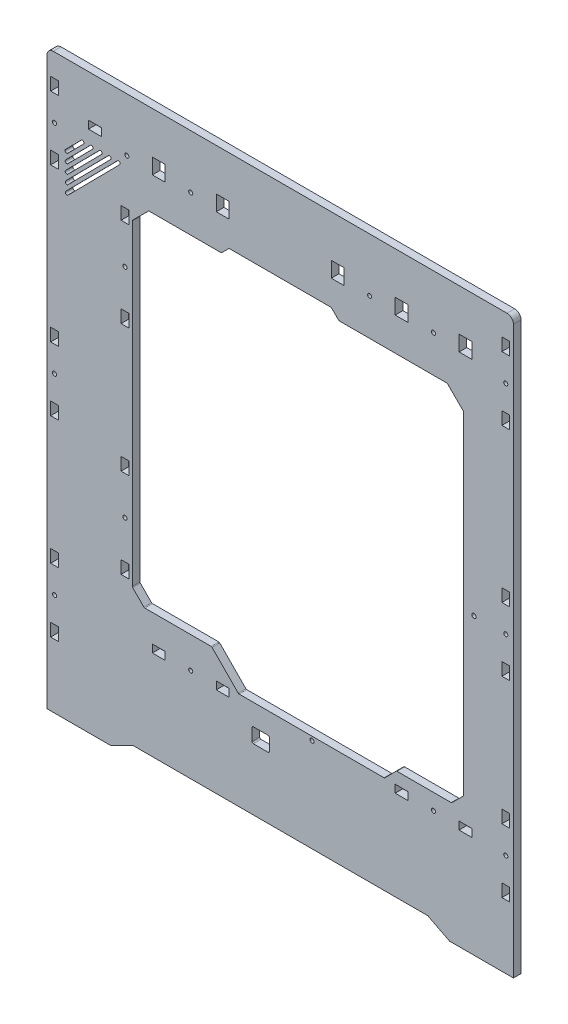
from build123d import *

# Parameters (mm, degrees)
SKETCH_1_W      = 6.1
SKETCH_1_H      = 10
SKETCH_1_R      = 1.6
SKETCH_1_W_2    = 10
SKETCH_1_H_2    = 6.1
SKETCH_1_H_3    = 12.1
SKETCH_1_R_2    = 1.7
EXTRUDE_1_DEPTH = 6


with BuildPart() as part:
    # Эскиз1 → Бобышка-Вытянуть1 (new body)
    with BuildSketch(Plane.XY):
        with BuildLine():
            Line((909.866546195, 490.00723929), (830.508682195, 490.00723929))
            Line((830.508682195, 490.00723929), (773.366546195, 490.00723929))
            ThreePointArc((773.366546195, 490.00723929), (769.831012289, 488.542773196), (768.366546195, 485.00723929))
            Line((768.366546195, 485.00723929), (768.366546195, 477.00723929))
            Line((768.366546195, 477.00723929), (768.366546195, 42.00723929))
            Line((768.366546195, 42.00723929), (818.366546195, 42.00723929))
            Line((818.366546195, 42.00723929), (835.366546195, 50.73749629))
            Line((835.366546195, 50.73749629), (1066.366546195, 50.73749629))
            Line((1066.366546195, 50.73749629), (1083.366546195, 42.00723929))
            Line((1083.366546195, 42.00723929), (1133.366546195, 42.00723929))
            Line((1133.366546195, 42.00723929), (1133.366546195, 477.00723929))
            Line((1133.366546195, 477.00723929), (1133.366546195, 485.00723929))
            ThreePointArc((1133.366546195, 485.00723929), (1131.902080101, 488.542773196), (1128.366546195, 490.00723929))
            Line((1128.366546195, 490.00723929), (909.866546195, 490.00723929))
        make_face()
        with Locations((774.316546195, 97.00723929)):
            Rectangle(SKETCH_1_W, SKETCH_1_H, mode=Mode.SUBTRACT)
        with Locations((774.316546195, 122.00723929)):
            Circle(SKETCH_1_R, mode=Mode.SUBTRACT)
        with Locations((774.316546195, 147.00723929)):
            Rectangle(SKETCH_1_W, SKETCH_1_H, mode=Mode.SUBTRACT)
        with Locations((855.866546195, 124.05491429)):
            Rectangle(SKETCH_1_W_2, SKETCH_1_H_2, mode=Mode.SUBTRACT)
        with Locations((880.866546195, 124.05491429)):
            Circle(SKETCH_1_R, mode=Mode.SUBTRACT)
        with Locations((905.866546195, 124.05491429)):
            Rectangle(SKETCH_1_W_2, SKETCH_1_H_2, mode=Mode.SUBTRACT)
        with BuildLine():
            Line((929.866546195, 110.50491429), (941.366546195, 110.50491429))
            ThreePointArc((941.366546195, 110.50491429), (942.073652976, 110.212021071), (942.366546195, 109.50491429))
            Line((942.366546195, 109.50491429), (942.366546195, 100.00491429))
            ThreePointArc((942.366546195, 100.00491429), (942.073652976, 99.297807509), (941.366546195, 99.00491429))
            Line((941.366546195, 99.00491429), (929.866546195, 99.00491429))
            ThreePointArc((929.866546195, 99.00491429), (929.159439413, 99.297807509), (928.866546195, 100.00491429))
            Line((928.866546195, 100.00491429), (928.866546195, 109.50491429))
            ThreePointArc((928.866546195, 109.50491429), (929.159439413, 110.212021071), (929.866546195, 110.50491429))
        make_face(mode=Mode.SUBTRACT)
        with Locations((829.416546195, 167.00723929)):
            Rectangle(SKETCH_1_W, SKETCH_1_H, mode=Mode.SUBTRACT)
        with Locations((829.416546195, 202.00723929)):
            Circle(SKETCH_1_R, mode=Mode.SUBTRACT)
        with Locations((774.316546195, 247.00723929)):
            Rectangle(SKETCH_1_W, SKETCH_1_H, mode=Mode.SUBTRACT)
        with Locations((829.416546195, 237.00723929)):
            Rectangle(SKETCH_1_W, SKETCH_1_H, mode=Mode.SUBTRACT)
        with Locations((975.866546195, 124.05491402)):
            Circle(SKETCH_1_R, mode=Mode.SUBTRACT)
        with Locations((1127.416546195, 97.00723929)):
            Rectangle(SKETCH_1_W, SKETCH_1_H, mode=Mode.SUBTRACT)
        with Locations((1045.866546195, 124.05491429)):
            Rectangle(SKETCH_1_W_2, SKETCH_1_H_2, mode=Mode.SUBTRACT)
        with Locations((1070.866546195, 124.05491429)):
            Circle(SKETCH_1_R, mode=Mode.SUBTRACT)
        with Locations((1095.866546195, 124.05491429)):
            Rectangle(SKETCH_1_W_2, SKETCH_1_H_2, mode=Mode.SUBTRACT)
        with Locations((1127.416546195, 122.00723929)):
            Circle(SKETCH_1_R, mode=Mode.SUBTRACT)
        with Locations((1127.416546195, 147.00723929)):
            Rectangle(SKETCH_1_W, SKETCH_1_H, mode=Mode.SUBTRACT)
        with Locations((1127.416546195, 247.00723929)):
            Rectangle(SKETCH_1_W, SKETCH_1_H, mode=Mode.SUBTRACT)
        with Locations((774.316546195, 272.00723929)):
            Circle(SKETCH_1_R, mode=Mode.SUBTRACT)
        with Locations((774.316546195, 297.00723929)):
            Rectangle(SKETCH_1_W, SKETCH_1_H, mode=Mode.SUBTRACT)
        with Locations((829.416546195, 337.00723929)):
            Rectangle(SKETCH_1_W, SKETCH_1_H, mode=Mode.SUBTRACT)
        with Locations((829.416546195, 372.00723929)):
            Circle(SKETCH_1_R, mode=Mode.SUBTRACT)
        with Locations((774.316546195, 417.00723929)):
            Rectangle(SKETCH_1_W, SKETCH_1_H, mode=Mode.SUBTRACT)
        with BuildLine():
            Line((797.021693195, 438.99752529), (784.715878195, 426.55498029))
            ThreePointArc((784.715878195, 426.55498029), (782.948138695, 426.54521379), (782.938372195, 428.31295329))
            Line((782.938372195, 428.31295329), (795.244186195, 440.75549829))
            ThreePointArc((795.244186195, 440.75549829), (797.011926195, 440.76526529), (797.021693195, 438.99752529))
        make_face(mode=Mode.SUBTRACT)
        with BuildLine():
            Line((825.305532195, 439.15378929), (784.872143195, 398.27114029))
            ThreePointArc((784.872143195, 398.27114029), (783.104403195, 398.26137329), (783.094636195, 400.02911329))
            Line((783.094636195, 400.02911329), (823.528026195, 440.91176329))
            ThreePointArc((823.528026195, 440.91176329), (825.295766195, 440.92152929), (825.305532195, 439.15378929))
        make_face(mode=Mode.SUBTRACT)
        with BuildLine():
            Line((818.234572195, 439.11472329), (784.833077195, 405.34210029))
            ThreePointArc((784.833077195, 405.34210029), (783.065337195, 405.33233329), (783.055570195, 407.10007329))
            Line((783.055570195, 407.10007329), (816.457066195, 440.87269729))
            ThreePointArc((816.457066195, 440.87269729), (818.224806195, 440.88246329), (818.234572195, 439.11472329))
        make_face(mode=Mode.SUBTRACT)
        with BuildLine():
            Line((811.163612195, 439.07565729), (784.794011195, 412.41306029))
            ThreePointArc((784.794011195, 412.41306029), (783.026271195, 412.40329329), (783.016504195, 414.17103329))
            Line((783.016504195, 414.17103329), (809.386106195, 440.83363129))
            ThreePointArc((809.386106195, 440.83363129), (811.153846195, 440.84339729), (811.163612195, 439.07565729))
        make_face(mode=Mode.SUBTRACT)
        with BuildLine():
            Line((804.092652195, 439.03659129), (784.754944195, 419.48402029))
            ThreePointArc((784.754944195, 419.48402029), (782.987204695, 419.47425379), (782.977438195, 421.24199329))
            Line((782.977438195, 421.24199329), (802.315146195, 440.79456529))
            ThreePointArc((802.315146195, 440.79456529), (804.082886195, 440.80433129), (804.092652195, 439.03659129))
        make_face(mode=Mode.SUBTRACT)
        with Locations((829.416546195, 407.00723929)):
            Rectangle(SKETCH_1_W, SKETCH_1_H, mode=Mode.SUBTRACT)
        with Locations((774.316546195, 442.00723929)):
            Circle(SKETCH_1_R, mode=Mode.SUBTRACT)
        with Locations((805.866546195, 454.05723929)):
            Rectangle(SKETCH_1_W_2, SKETCH_1_H_2, mode=Mode.SUBTRACT)
        with Locations((774.316546195, 467.00723929)):
            Rectangle(SKETCH_1_W, SKETCH_1_H, mode=Mode.SUBTRACT)
        with Locations((830.866546195, 448.05723929)):
            Circle(SKETCH_1_R, mode=Mode.SUBTRACT)
        with Locations((855.866546195, 451.05723929)):
            Rectangle(SKETCH_1_W_2, SKETCH_1_H_3, mode=Mode.SUBTRACT)
        with Locations((880.866546195, 448.05723929)):
            Circle(SKETCH_1_R, mode=Mode.SUBTRACT)
        with Locations((905.866546195, 451.05723929)):
            Rectangle(SKETCH_1_W_2, SKETCH_1_H_3, mode=Mode.SUBTRACT)
        with BuildLine():
            Line((991.452332632, 424.583526443), (996.280759757, 419.755099318))
            ThreePointArc((996.280759757, 419.755099318), (996.929606455, 419.321553816), (997.694973319, 419.169312881))
            Line((997.694973319, 419.169312881), (1081.122260515, 419.169312881))
            ThreePointArc((1081.122260515, 419.169312881), (1081.50331118, 419.093867148), (1081.826864515, 418.878913881))
            Line((1081.826864515, 418.878913881), (1094.120077515, 406.672272881))
            ThreePointArc((1094.120077515, 406.672272881), (1094.338675602, 406.346986998), (1094.415473515, 405.962671881))
            Line((1094.415473515, 405.962671881), (1094.415473515, 146.420031881))
            ThreePointArc((1094.415473515, 146.420031881), (1094.340368819, 146.039810505), (1094.126336515, 145.716701881))
            Line((1094.126336515, 145.716701881), (1085.357153515, 136.853593881))
            ThreePointArc((1085.357153515, 136.853593881), (1085.031432616, 136.634066807), (1084.646289515, 136.556923881))
            Line((1084.646289515, 136.556923881), (1042.289008515, 136.556923881))
            ThreePointArc((1042.289008515, 136.556923881), (1041.903865529, 136.479781416), (1041.578144515, 136.260254881))
            Line((1041.578144515, 136.260254881), (1032.813350515, 127.401582881))
            ThreePointArc((1032.813350515, 127.401582881), (1032.487630078, 127.182055999), (1032.102487515, 127.104912881))
            Line((1032.102487515, 127.104912881), (918.728979515, 127.104912881))
            ThreePointArc((918.728979515, 127.104912881), (918.34230769, 127.182695398), (918.015788515, 127.403942881))
            Line((918.015788515, 127.403942881), (897.574498515, 148.201603881))
            ThreePointArc((897.574498515, 148.201603881), (897.24797934, 148.422851364), (896.861307515, 148.500633881))
            Line((896.861307515, 148.500633881), (844.938460515, 148.500633881))
            ThreePointArc((844.938460515, 148.500633881), (844.553318068, 148.577776538), (844.227597515, 148.797302881))
            Line((844.227597515, 148.797302881), (835.458413515, 157.660410881))
            ThreePointArc((835.458413515, 157.660410881), (835.244381748, 157.983519619), (835.169277515, 158.363740881))
            Line((835.169277515, 158.363740881), (835.169277515, 405.962671881))
            ThreePointArc((835.169277515, 405.962671881), (835.246075427, 406.346986998), (835.464673515, 406.672272881))
            Line((835.464673515, 406.672272881), (847.757886515, 418.878913881))
            ThreePointArc((847.757886515, 418.878913881), (848.08143985, 419.093867148), (848.462490515, 419.169312881))
            Line((848.462490515, 419.169312881), (904.03811907, 419.169312881))
            ThreePointArc((904.03811907, 419.169312881), (904.803485935, 419.321553816), (905.452332632, 419.755099318))
            Line((905.452332632, 419.755099318), (910.280759757, 424.583526443))
            ThreePointArc((910.280759757, 424.583526443), (910.929606455, 425.017071946), (911.694973319, 425.169312881))
            Line((911.694973319, 425.169312881), (990.03811907, 425.169312881))
            ThreePointArc((990.03811907, 425.169312881), (990.803485935, 425.017071946), (991.452332632, 424.583526443))
        make_face(mode=Mode.SUBTRACT)
        with Locations((1102.521049053, 272.00723929)):
            Circle(SKETCH_1_R_2, mode=Mode.SUBTRACT)
        with Locations((1127.416546195, 272.00723929)):
            Circle(SKETCH_1_R, mode=Mode.SUBTRACT)
        with Locations((1127.416546195, 297.00723929)):
            Rectangle(SKETCH_1_W, SKETCH_1_H, mode=Mode.SUBTRACT)
        with Locations((995.866546195, 451.05723929)):
            Rectangle(SKETCH_1_W_2, SKETCH_1_H_3, mode=Mode.SUBTRACT)
        with Locations((1020.866546195, 448.05723929)):
            Circle(SKETCH_1_R, mode=Mode.SUBTRACT)
        with Locations((1127.416546195, 417.00723929)):
            Rectangle(SKETCH_1_W, SKETCH_1_H, mode=Mode.SUBTRACT)
        with Locations((1045.866546195, 451.05723929)):
            Rectangle(SKETCH_1_W_2, SKETCH_1_H_3, mode=Mode.SUBTRACT)
        with Locations((1070.866546195, 448.05723929)):
            Circle(SKETCH_1_R, mode=Mode.SUBTRACT)
        with Locations((1095.866546195, 451.05723929)):
            Rectangle(SKETCH_1_W_2, SKETCH_1_H_3, mode=Mode.SUBTRACT)
        with Locations((1127.416546195, 442.00723929)):
            Circle(SKETCH_1_R, mode=Mode.SUBTRACT)
        with Locations((1127.416546195, 467.00723929)):
            Rectangle(SKETCH_1_W, SKETCH_1_H, mode=Mode.SUBTRACT)
    extrude(amount=EXTRUDE_1_DEPTH)


solid = part.part
